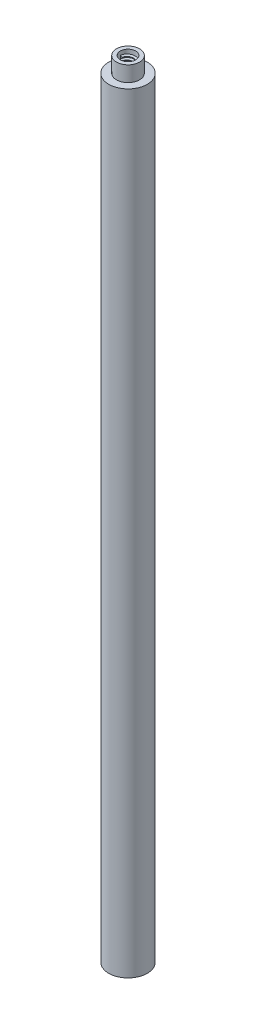
from build123d import *

# Parameters (mm, degrees)
IZIM3_R               = 1
KES_EKSTR_ZYON1_DEPTH = 5
DI_1_PITCH            = 0.4


with BuildPart() as part:
    # Çizim2 → Döndür2 (revolve)
    with BuildSketch(Plane.XY, mode=Mode.PRIVATE) as d_nd_r2_sk:
        Polygon((1, 100), (1, 102), (2.5, 102), (2.5, 0), (0, 0), (0, 100), align=None)
    revolve(d_nd_r2_sk.sketch.rotate(Axis((2.5, -8.529590989, 0), (0, 1, 0)), 270), axis=Axis((2.5, -8.529590989, 0), (0, 1, 0)))

    # Çizim3 → Kes-Ekstrüzyon1 (cut)
    with BuildSketch(Plane(origin=(0, 102, 0), x_dir=(1, 0, 0), z_dir=(0, 1, 0))):
        with Locations(Location((2.5, 0, 0), (0, 0, 270))):
            Circle(IZIM3_R)
    extrude(amount=-KES_EKSTR_ZYON1_DEPTH, mode=Mode.SUBTRACT)

    # Diş1: the profile of Diş Profili1 profile screwed along a right-hand helix of 12.5 turns, 6 arcs to a turn; built about Z, then put on its axis
    di_1_z = Axis((0, 0, 0), (0, 0, 1))
    di_1_corners = [(1.0003, 0, -0.000173205), (1.0003, 0, 0.350173204), (0.78349365, 0, 0.224999999), (0.78349365, 0, 0.124999999)]
    with BuildLine(mode=Mode.PRIVATE) as di_1_profile:
        Line(di_1_corners[0], di_1_corners[1])
        Line(di_1_corners[1], di_1_corners[2])
        Line(di_1_corners[2], di_1_corners[3])
        Line(di_1_corners[3], di_1_corners[0])
    di_1_cap = Face(di_1_profile.wire())
    di_1_turn_angles = [0, 30, 60, 90, 120, 150, 180, 210, 240, 270, 300, 330, 360]
    di_1_turn_weights = [1, 0.8660254037844387, 1, 0.8660254037844387, 1, 0.8660254037844387, 1, 0.8660254037844387, 1, 0.8660254037844387, 1, 0.8660254037844387, 1]
    di_1_turn_rails = [Edge.make_bspline([Vector(p[0], p[1], 0).rotate(di_1_z, di_1_turn_angles[k]) / di_1_turn_weights[k] + Vector(0, 0, p[2] + DI_1_PITCH * di_1_turn_angles[k] / 360) for k in range(13)], [0, 0, 0, 1, 1, 2, 2, 3, 3, 4, 4, 5, 5, 6, 6, 6], 2, di_1_turn_weights) for p in di_1_corners]
    di_1_turn_sides = [Face.make_surface_from_curves(di_1_turn_rails[p[0]], di_1_turn_rails[p[1]]) for p in [(0, 1), (1, 2), (2, 3), (3, 0)]]
    di_1_last_angles = [4320, 4350, 4380, 4410, 4440, 4470, 4500]
    di_1_last_weights = [1, 0.8660254037844387, 1, 0.8660254037844387, 1, 0.8660254037844387, 1]
    di_1_last_rails = [Edge.make_bspline([Vector(p[0], p[1], 0).rotate(di_1_z, di_1_last_angles[k]) / di_1_last_weights[k] + Vector(0, 0, p[2] + DI_1_PITCH * di_1_last_angles[k] / 360) for k in range(7)], [0, 0, 0, 1, 1, 2, 2, 3, 3, 3], 2, di_1_last_weights) for p in di_1_corners]
    di_1_last_sides = [Face.make_surface_from_curves(di_1_last_rails[p[0]], di_1_last_rails[p[1]]) for p in [(0, 1), (1, 2), (2, 3), (3, 0)]]
    di_1 = Plane(origin=(2.5, 101.5, 0), x_dir=(-1, 0, 0), z_dir=(0, -1, 0)) * Solid(Shell([*[p.moved(Location((0, 0, DI_1_PITCH * i))) for i in range(12) for p in di_1_turn_sides], *di_1_last_sides, di_1_cap, di_1_cap.rotate(di_1_z, 4500).moved(Location((0, 0, DI_1_PITCH * 4500 / 360)))]))
    add(di_1)


solid = part.part
